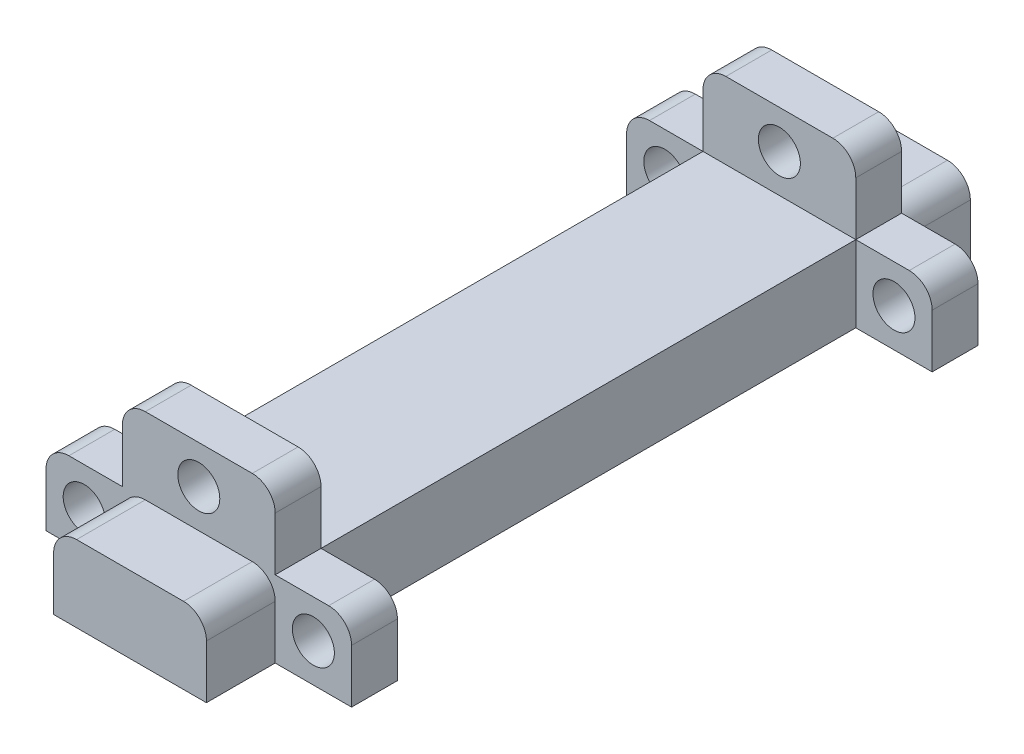
from build123d import *

# Parameters (mm, degrees)
SKETCH_1_W               = 20
SKETCH_1_H               = 10
EXTRUDE_1_DEPTH          = 100
EXTRUDE_START            = -9
SKETCH_2_W               = 10
SKETCH_2_H               = 10
SKETCH_2_W_2             = 20
EXTRUDE_2_DEPTH          = 6
CUT_EXTRUDE_1_DEPTH      = 98.88258272
CUT_EXTRUDE_1_DEPTH_BACK = 98.88258272
SKETCH_3_R               = 2.75
FILLET_1_R               = 3


with BuildPart() as part:
    # 草图1 → 凸台-拉伸1 (new body)
    with BuildSketch(Plane.XY):
        with Locations((10, 5)):
            Rectangle(SKETCH_1_W, SKETCH_1_H)
    extrude(amount=EXTRUDE_1_DEPTH)

    # 草图2 → 凸台-拉伸2 (add)
    with BuildSketch(Plane(origin=(0, 0, 0), x_dir=(-1, 0, 0), z_dir=(0, 0, -1)).offset(EXTRUDE_START)):
        with Locations((-25, 5)):
            Rectangle(SKETCH_2_W, SKETCH_2_H)
        with Locations((-10, 15)):
            Rectangle(SKETCH_2_W_2, SKETCH_2_H)
        with Locations((5, 5)):
            Rectangle(SKETCH_2_W, SKETCH_2_H)
    extrude_2 = extrude(amount=-EXTRUDE_2_DEPTH)

    # 镜向1: 凸台-拉伸2 across plane
    add(extrude_2.mirror(Plane(origin=(0, 0, 50), x_dir=(1, 0, 0), z_dir=(0, 0, -1))))

    # 草图3 → 切除-拉伸1 (cut, two sides: drawn at the far end of the back side and taken through both)
    with BuildSketch(Plane(origin=(0, 0, 9), x_dir=(-1, 0, 0), z_dir=(0, 0, -1)).offset(-CUT_EXTRUDE_1_DEPTH_BACK)):
        with Locations(Location((5, 5, 0), (0, 0, 180))):
            Circle(SKETCH_3_R)
        with Locations(Location((-10, 15, 0), (0, 0, 180))):
            Circle(SKETCH_3_R)
        with Locations(Location((-25, 5, 0), (0, 0, 180))):
            Circle(SKETCH_3_R)
    extrude(amount=CUT_EXTRUDE_1_DEPTH + CUT_EXTRUDE_1_DEPTH_BACK, mode=Mode.SUBTRACT)

    # 圆角1
    # the kernel refuses this fillet: 3 mm, written as the material it takes off along each edge
    with BuildSketch(Plane(origin=(0, 10, -7.5), x_dir=(0, -1, 0), z_dir=(0, 0, 1)), Plane(origin=(0, 10, 91), x_dir=(0, -1, 0), z_dir=(0, 0, 1))) as fillet_1_piece_1:
        with BuildLine():
            CenterArc((FILLET_1_R, FILLET_1_R), FILLET_1_R, 180, 90)
            Line((0, FILLET_1_R), (0, 0))
            Line((0, 0), (FILLET_1_R, 0))
        make_face()
    extrude(amount=16.5, mode=Mode.SUBTRACT)
    with BuildSketch(Plane(origin=(20, 10, -7.5), x_dir=(0, -1, 0), z_dir=(0, 0, 1)), Plane(origin=(20, 10, 91), x_dir=(0, -1, 0), z_dir=(0, 0, 1))) as fillet_1_piece_2:
        with BuildLine():
            CenterArc((FILLET_1_R, -FILLET_1_R), FILLET_1_R, 90, 90)
            Line((0, -FILLET_1_R), (0, 0))
            Line((0, 0), (FILLET_1_R, 0))
        make_face()
    extrude(amount=16.5, mode=Mode.SUBTRACT)
    with BuildSketch(Plane(origin=(20, 20, 1.5), x_dir=(0, -1, 0), z_dir=(0, 0, 1)), Plane(origin=(30, 10, 1.5), x_dir=(0, -1, 0), z_dir=(0, 0, 1)), Plane(origin=(0, 20, 98.5), x_dir=(0, -1, 0), z_dir=(0, 0, -1)), Plane(origin=(-10, 10, 98.5), x_dir=(0, -1, 0), z_dir=(0, 0, -1))) as fillet_1_piece_3:
        with BuildLine():
            CenterArc((FILLET_1_R, -FILLET_1_R), FILLET_1_R, 90, 90)
            Line((0, -FILLET_1_R), (0, 0))
            Line((0, 0), (FILLET_1_R, 0))
        make_face()
    extrude(amount=21, mode=Mode.SUBTRACT)
    with BuildSketch(Plane(origin=(0, 20, 1.5), x_dir=(0, -1, 0), z_dir=(0, 0, 1)), Plane(origin=(-10, 10, 1.5), x_dir=(0, -1, 0), z_dir=(0, 0, 1)), Plane(origin=(30, 10, 98.5), x_dir=(0, -1, 0), z_dir=(0, 0, -1)), Plane(origin=(20, 20, 98.5), x_dir=(0, -1, 0), z_dir=(0, 0, -1))) as fillet_1_piece_4:
        with BuildLine():
            CenterArc((FILLET_1_R, FILLET_1_R), FILLET_1_R, 180, 90)
            Line((0, FILLET_1_R), (0, 0))
            Line((0, 0), (FILLET_1_R, 0))
        make_face()
    extrude(amount=21, mode=Mode.SUBTRACT)


solid = part.part
